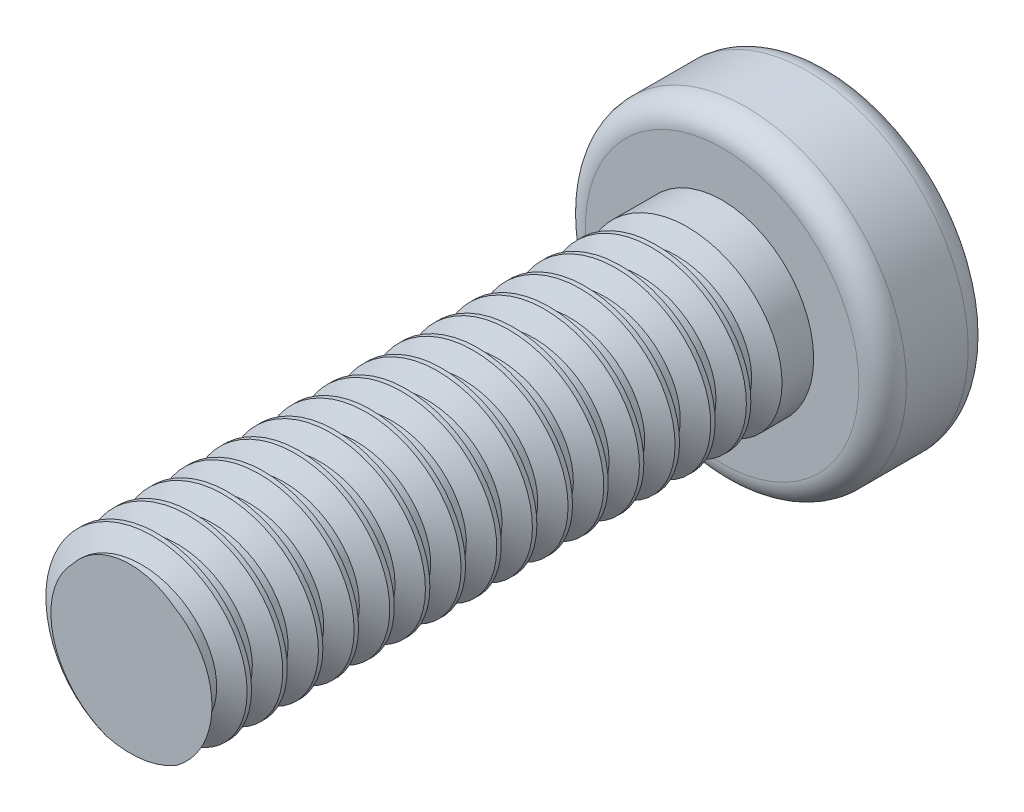
from build123d import *

# Parameters (mm, degrees)
BOSS_EXTRUDE1_DEPTH = 4.6
SKETCH3_R           = 3.85
BOSS_EXTRUDE2_DEPTH = 24.9
SKETCH4_OUTSIDE_W   = 23.252
SKETCH4_OUTSIDE_H   = 24.784
SKETCH4_OUTSIDE_R   = 6.75
CUT_EXTRUDE3_DEPTH  = 24.9
CUT_EXTRUDE4_DEPTH  = 3.5
FILLET8_R           = 1
THREAD8_PITCH       = 1.5


with BuildPart() as part:
    # Sketch1 → Boss-Extrude1 (new body)
    with BuildSketch(Plane.XY):
        Polygon((7.009182578, -3.409011527), (6.456881873, 4.365624409), (-0.552300705, 7.774635936), (-7.009182578, 3.409011527), (-6.456881873, -4.365624409), (0.552300705, -7.774635936), align=None)
    extrude(amount=BOSS_EXTRUDE1_DEPTH)

    # Sketch3 → Boss-Extrude2 (add)
    with BuildSketch(Plane.XY.offset(4.6)):
        Circle(SKETCH3_R)
    extrude(amount=BOSS_EXTRUDE2_DEPTH)

    # Sketch4 outside → Cut-Extrude3 (cut)
    with BuildSketch(Plane.XY.offset(4.6)):
        Rectangle(SKETCH4_OUTSIDE_W, SKETCH4_OUTSIDE_H)
        Circle(SKETCH4_OUTSIDE_R, mode=Mode.SUBTRACT)
    extrude(amount=-CUT_EXTRUDE3_DEPTH, mode=Mode.SUBTRACT)

    # Sketch13 → Cut-Extrude4 (cut)
    with BuildSketch(Plane(origin=(0, 0, 0), x_dir=(-1, 0, 0), z_dir=(0, 0, -1))):
        Polygon((1.598245793, 2.359684383), (-1.244423724, 2.563963649), (-2.842669517, 0.204279267), (-1.598245793, -2.359684383), (1.244423724, -2.563963649), (2.842669517, -0.204279267), align=None)
    extrude(amount=-CUT_EXTRUDE4_DEPTH, mode=Mode.SUBTRACT)

    # Fillet8
    fillet8_edges = [part.edges().sort_by_distance(p)[0] for p in [
        (-6.75, 0, 0),
        (-6.75, 0, 4.6),
    ]]
    fillet(fillet8_edges, radius=FILLET8_R)

    # Thread8: arcs per turn and ends read off the stored shape
    # Thread8: the profile of Thread Profile8 profile screwed along a right-hand helix through 22 turns, 8 arcs to a turn; built about Z, then put on its axis
    thread8_z = Axis((0, 0, 0), (0, 0, 1))
    thread8_corners = [(3.8503, 0, -33.000173205), (3.8503, 0, -31.687326799), (3.038101187, 0, -32.156250002), (3.038101187, 0, -32.531250002)]
    with BuildLine(mode=Mode.PRIVATE) as thread8_profile:
        Line(thread8_corners[0], thread8_corners[1])
        Line(thread8_corners[1], thread8_corners[2])
        Line(thread8_corners[2], thread8_corners[3])
        Line(thread8_corners[3], thread8_corners[0])
    thread8_cap = Face(thread8_profile.wire())
    thread8_turn_angles = [0, 22.5, 45, 67.5, 90, 112.5, 135, 157.5, 180, 202.5, 225, 247.5, 270, 292.5, 315, 337.5, 360]
    thread8_turn_weights = [1, 0.9238795325112867, 1, 0.9238795325112867, 1, 0.9238795325112867, 1, 0.9238795325112867, 1, 0.9238795325112867, 1, 0.9238795325112867, 1, 0.9238795325112867, 1, 0.9238795325112867, 1]
    thread8_turn_rails = [Edge.make_bspline([Vector(p[0], p[1], 0).rotate(thread8_z, thread8_turn_angles[k]) / thread8_turn_weights[k] + Vector(0, 0, p[2] + THREAD8_PITCH * thread8_turn_angles[k] / 360) for k in range(17)], [0, 0, 0, 1, 1, 2, 2, 3, 3, 4, 4, 5, 5, 6, 6, 7, 7, 8, 8, 8], 2, thread8_turn_weights) for p in thread8_corners]
    thread8_turn_sides = [Face.make_surface_from_curves(thread8_turn_rails[p[0]], thread8_turn_rails[p[1]]) for p in [(0, 1), (1, 2), (2, 3), (3, 0)]]
    thread8 = Plane(origin=(0, 0, 6.5), x_dir=(-1, 0, 0), z_dir=(0, 0, -1)) * Solid(Shell([*[p.moved(Location((0, 0, THREAD8_PITCH * i))) for i in range(22) for p in thread8_turn_sides], thread8_cap, thread8_cap.rotate(thread8_z, 7920).moved(Location((0, 0, THREAD8_PITCH * 7920 / 360)))]))
    add(thread8, mode=Mode.SUBTRACT)


solid = part.part
